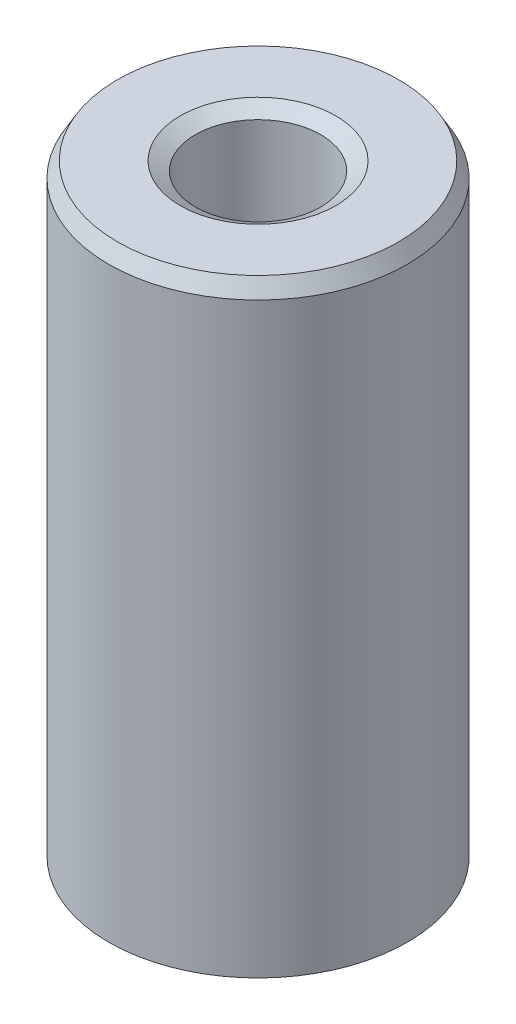
from build123d import *
from OCP.BRepFilletAPI import BRepFilletAPI_MakeChamfer

# Parameters (mm, degrees)
SKETCH1_R           = 37.5
BOSS_EXTRUDE1_DEPTH = 153.485703597
SKETCH2_R           = 15.755691303
CUT_EXTRUDE1_DEPTH  = 163.389535404
CHAMFER1_SIZE       = 3.796998522
CHAMFER1_SIZE2      = 2.192198119


with BuildPart() as part:
    # Sketch1 → Boss-Extrude1 (new body)
    with BuildSketch(Plane(origin=(0, 0, 0), x_dir=(1, 0, 0), z_dir=(0, 1, 0))):
        Circle(SKETCH1_R)
    extrude(amount=BOSS_EXTRUDE1_DEPTH)

    # Sketch2 → Cut-Extrude1 (cut, through all)
    with BuildSketch(Plane(origin=(0, 0, 0), x_dir=(1, 0, 0), z_dir=(0, 1, 0))):
        Circle(SKETCH2_R)
    extrude(amount=CUT_EXTRUDE1_DEPTH, mode=Mode.SUBTRACT)

    # Chamfer1: one chamfer whose edges measure the first distance from different faces: ONE call of the kernel's chamfer builder (chamfer() names one face for all edges)
    chamfer1_edges_1 = [part.edges().sort_by_distance(p)[0] for p in [
        (-15.755691303, 153.485703597, 0),
    ]]
    chamfer1_side_1 = [part.faces().sort_by_distance(p)[0] for p in [
        (-36.439339828, 153.485703597, 0),
    ]]
    chamfer1_edges_2 = [part.edges().sort_by_distance(p)[0] for p in [
        (-15.755691303, 0, 0),
    ]]
    chamfer1_side_2 = [part.faces().sort_by_distance(p)[0] for p in [
        (-15.755691303, 76.742851798, 0),
    ]]
    chamfer1_edges_3 = [part.edges().sort_by_distance(p)[0] for p in [
        (-37.5, 0, 0),
    ]]
    chamfer1_side_3 = [part.faces().sort_by_distance(p)[0] for p in [
        (-36.439339828, 0, 0),
    ]]
    chamfer1_edges_4 = [part.edges().sort_by_distance(p)[0] for p in [
        (-37.5, 153.485703597, 0),
    ]]
    chamfer1_side_4 = [part.faces().sort_by_distance(p)[0] for p in [
        (-37.5, 76.742851798, 0),
    ]]
    chamfer1 = BRepFilletAPI_MakeChamfer(part.part.solid().wrapped)
    for e in chamfer1_edges_1:
        chamfer1.Add(CHAMFER1_SIZE, CHAMFER1_SIZE2, e.wrapped, chamfer1_side_1[0].wrapped)  # the first distance lies on this face
    for e in chamfer1_edges_2:
        chamfer1.Add(CHAMFER1_SIZE, CHAMFER1_SIZE2, e.wrapped, chamfer1_side_2[0].wrapped)  # the first distance lies on this face
    for e in chamfer1_edges_3:
        chamfer1.Add(CHAMFER1_SIZE, CHAMFER1_SIZE2, e.wrapped, chamfer1_side_3[0].wrapped)  # the first distance lies on this face
    for e in chamfer1_edges_4:
        chamfer1.Add(CHAMFER1_SIZE, CHAMFER1_SIZE2, e.wrapped, chamfer1_side_4[0].wrapped)  # the first distance lies on this face
    add(Compound.cast(chamfer1.Shape()), mode=Mode.REPLACE)


solid = part.part
